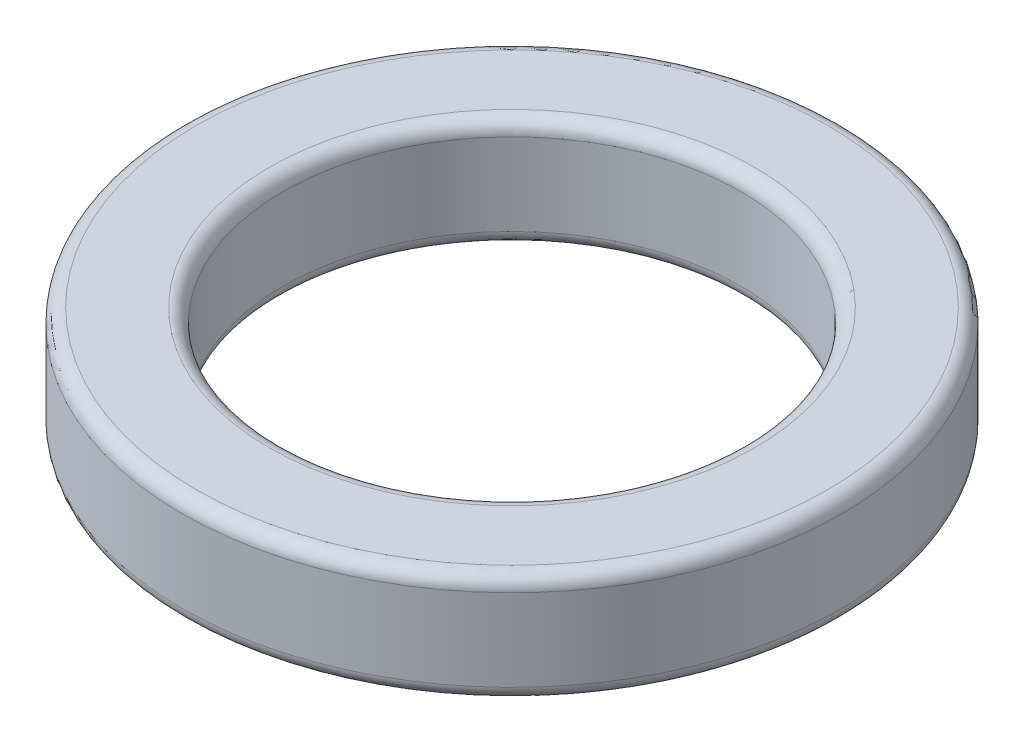
from build123d import *

# Parameters (mm, degrees)
SKETCH1_R           = 36
SKETCH1_R_2         = 25
BOSS_EXTRUDE1_DEPTH = 6
FILLET1_R           = 1.524


with BuildPart() as part:
    # Sketch1 → Boss-Extrude1 (new, symmetric)
    with BuildSketch(Plane(origin=(0, 0, 0), x_dir=(1, 0, 0), z_dir=(0, 1, 0))):
        Circle(SKETCH1_R)
        Circle(SKETCH1_R_2, mode=Mode.SUBTRACT)
    extrude(amount=BOSS_EXTRUDE1_DEPTH, both=True)

    # Fillet1
    fillet1_edges = [part.edges().sort_by_distance(p)[0] for p in [
        (-36, -6, 0),
        (-25, -6, 0),
        (-25, 6, 0),
        (-36, 6, 0),
    ]]
    fillet(fillet1_edges, radius=FILLET1_R)


solid = part.part
